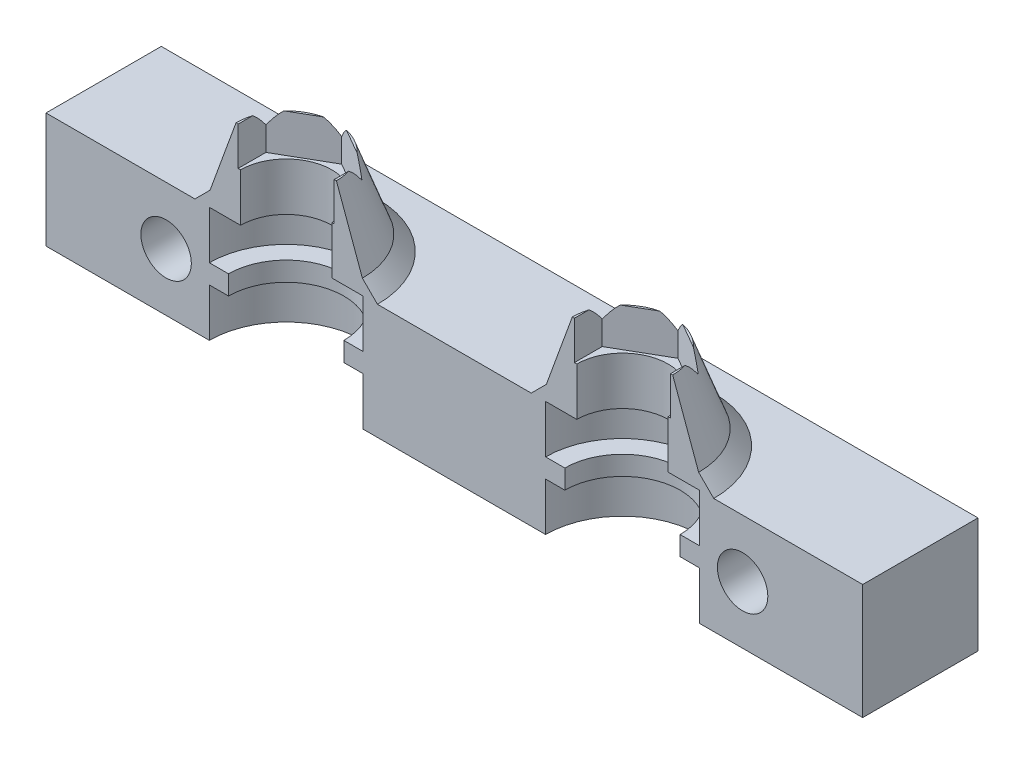
from build123d import *

# Parameters (mm, degrees)
SKETCH1_W                     = 85
SKETCH1_H                     = 12
BOSS_EXTRUDE1_DEPTH           = 12
SKETCH2_R                     = 8
CUT_EXTRUDE2_DEPTH            = 5
CUT_EXTRUDE3_START            = -5
SKETCH3_R                     = 8
CUT_EXTRUDE3_DEPTH            = 5
CUT_EXTRUDE4_DEPTH            = 45.567364741
CUT_EXTRUDE4_DEPTH_BACK       = 45.567364741
SKETCH4_R                     = 6
SKETCH5_R                     = 2.625
CUT_EXTRUDE6_DEPTH            = 45.567364741
SKETCH7_R                     = 8.5
BOSS_EXTRUDE3_DEPTH           = 9
BOSS_EXTRUDE3_DRAFT           = 20
BOSS_EXTRUDE3_PROFILE_2_DEPTH = 9
BOSS_EXTRUDE3_PROFILE_2_DRAFT = 20
CHAMFER1_SIZE                 = 1.673157185
CHAMFER1_SIZE_2               = 1
CHAMFER2_SIZE                 = 1
CHAMFER2_SIZE_2               = 1.673157185
CUT_EXTRUDE9_DEPTH            = 4
SKETCH11_R                    = 4.75
CUT_EXTRUDE10_DEPTH           = 51.154760492
SKETCH12_W                    = 84.776225192
SKETCH12_H                    = 9.817436209
CUT_EXTRUDE11_DEPTH           = 52.647846034


with BuildPart() as part:
    # Sketch1 → Boss-Extrude1 (new body)
    with BuildSketch(Plane.XY):
        Rectangle(SKETCH1_W, SKETCH1_H)
    extrude(amount=BOSS_EXTRUDE1_DEPTH)

    # Sketch2 → Cut-Extrude2 (cut)
    with BuildSketch(Plane(origin=(0, 6, 0), x_dir=(1, 0, 0), z_dir=(0, 1, 0))):
        with Locations((-17.5, -12)):
            Circle(SKETCH2_R)
        with Locations((17.5, -12)):
            Circle(SKETCH2_R)
    extrude(amount=-CUT_EXTRUDE2_DEPTH, mode=Mode.SUBTRACT)

    # Sketch3 → Cut-Extrude3 (cut)
    with BuildSketch(Plane.XZ.offset(6).offset(CUT_EXTRUDE3_START)):
        with Locations((-17.5, 12)):
            Circle(SKETCH3_R)
        with Locations((17.5, 12)):
            Circle(SKETCH3_R)
    extrude(amount=CUT_EXTRUDE3_DEPTH, mode=Mode.SUBTRACT)

    # Sketch4 → Cut-Extrude4 (cut, two sides: drawn at the far end of the back side and taken through both)
    with BuildSketch(Plane(origin=(0, 0, 0), x_dir=(1, 0, 0), z_dir=(0, 1, 0)).offset(-CUT_EXTRUDE4_DEPTH_BACK)):
        with Locations((-17.5, -12)):
            Circle(SKETCH4_R)
        with Locations((17.5, -12)):
            Circle(SKETCH4_R)
    extrude(amount=CUT_EXTRUDE4_DEPTH + CUT_EXTRUDE4_DEPTH_BACK, mode=Mode.SUBTRACT)

    # Sketch5 → Cut-Extrude6 (cut, through all)
    with BuildSketch(Plane.XY.offset(12)):
        with Locations((-30, 0)):
            Circle(SKETCH5_R)
        with Locations((30, 0)):
            Circle(SKETCH5_R)
    extrude(amount=-CUT_EXTRUDE6_DEPTH, mode=Mode.SUBTRACT)


with BuildPart() as boss_extrude3_tool:
    # Sketch7 → Boss-Extrude3 (with draft: the straight prism first)
    with BuildSketch(Plane(origin=(0, 6, 0), x_dir=(1, 0, 0), z_dir=(0, 1, 0))):
        with Locations((-17.5, -12)):
            Circle(SKETCH7_R)
    extrude(amount=BOSS_EXTRUDE3_DEPTH)
    # Boss-Extrude3: the draft: its side faces are tilted about the plane it starts from
    boss_extrude3_sides = [boss_extrude3_tool.faces().sort_by_distance(p)[0] for p in [
        (-26, 10.5, 12),
    ]]
    draft(boss_extrude3_sides, Plane(origin=(0, 6, 0), x_dir=(1, 0, 0), z_dir=(0, 1, 0)), BOSS_EXTRUDE3_DRAFT)


with BuildPart() as part_1:
    add(part.part)

    # Boss-Extrude3: add boss_extrude3_tool
    add(boss_extrude3_tool.part)


with BuildPart() as boss_extrude3_profile_2_tool:
    # Sketch7 → Boss-Extrude3 profile 2 (with draft: the straight prism first)
    with BuildSketch(Plane(origin=(0, 6, 0), x_dir=(1, 0, 0), z_dir=(0, 1, 0))):
        with Locations((17.5, -12)):
            Circle(SKETCH7_R)
    extrude(amount=BOSS_EXTRUDE3_PROFILE_2_DEPTH)
    # Boss-Extrude3 profile 2: the draft: its side faces are tilted about the plane it starts from
    boss_extrude3_profile_2_sides = [boss_extrude3_profile_2_tool.faces().sort_by_distance(p)[0] for p in [
        (9, 10.5, 12),
    ]]
    draft(boss_extrude3_profile_2_sides, Plane(origin=(0, 6, 0), x_dir=(1, 0, 0), z_dir=(0, 1, 0)), BOSS_EXTRUDE3_PROFILE_2_DRAFT)


with BuildPart() as part_2:
    add(part_1.part)

    # Boss-Extrude3 profile 2: add boss_extrude3_profile_2_tool
    add(boss_extrude3_profile_2_tool.part)

    # Chamfer1
    # the kernel refuses this chamfer: 1.673157185, 1 mm, written as the material it adds along each edge
    with BuildSketch(Plane(origin=(-17.5, 6, 12), x_dir=(1, 0, 0), z_dir=(0, 0, 1))) as chamfer1_piece_1:
        Polygon((8.5 - CHAMFER1_SIZE * 0.342020143346, CHAMFER1_SIZE * 0.939692620843), (8.5 + CHAMFER1_SIZE_2, 0), (8.5, 0), align=None)
    revolve(axis=Axis((-17.5, 6, 12), (0, 1, 0)), revolution_arc=180)

    # Chamfer2
    # the kernel refuses this chamfer: 1.673157185, 1 mm, written as the material it adds along each edge
    with BuildSketch(Plane(origin=(17.5, 6, 12), x_dir=(1, 0, 0), z_dir=(0, 0, 1))) as chamfer2_piece_1:
        Polygon((8.5 + CHAMFER2_SIZE, 0), (8.5 - CHAMFER2_SIZE_2 * 0.342020143346, CHAMFER2_SIZE_2 * 0.939692620843), (8.5, 0), align=None)
    revolve(axis=Axis((17.5, 6, 12), (0, 1, 0)), revolution_arc=180)

    # Sketch10 → Cut-Extrude9 (cut)
    with BuildSketch(Plane(origin=(0, 15, 0), x_dir=(1, 0, 0), z_dir=(0, 1, 0))):
        Polygon((-17.5, -6.226497308), (-22.5, -9.113248654), (-22.5, -14.886751346), (-17.5, -17.773502692), (-12.5, -14.886751346), (-12.5, -9.113248654), align=None)
        Polygon((17.5, -6.226497308), (12.5, -9.113248654), (12.5, -14.886751346), (17.5, -17.773502692), (22.5, -14.886751346), (22.5, -9.113248654), align=None)
    extrude(amount=-CUT_EXTRUDE9_DEPTH, mode=Mode.SUBTRACT)

    # Sketch11 → Cut-Extrude10 (cut, through all)
    with BuildSketch(Plane(origin=(0, 11, 0), x_dir=(1, 0, 0), z_dir=(0, 1, 0))):
        with Locations((-17.5, -12)):
            Circle(SKETCH11_R)
        with Locations((17.5, -12)):
            Circle(SKETCH11_R)
    extrude(amount=-CUT_EXTRUDE10_DEPTH, mode=Mode.SUBTRACT)

    # Sketch12 → Cut-Extrude11 (cut, through all)
    with BuildSketch(Plane.XZ.offset(6)):
        with Locations((-0.111887404, 16.908718105)):
            Rectangle(SKETCH12_W, SKETCH12_H)
    extrude(amount=-CUT_EXTRUDE11_DEPTH, mode=Mode.SUBTRACT)


solid = part_2.part
